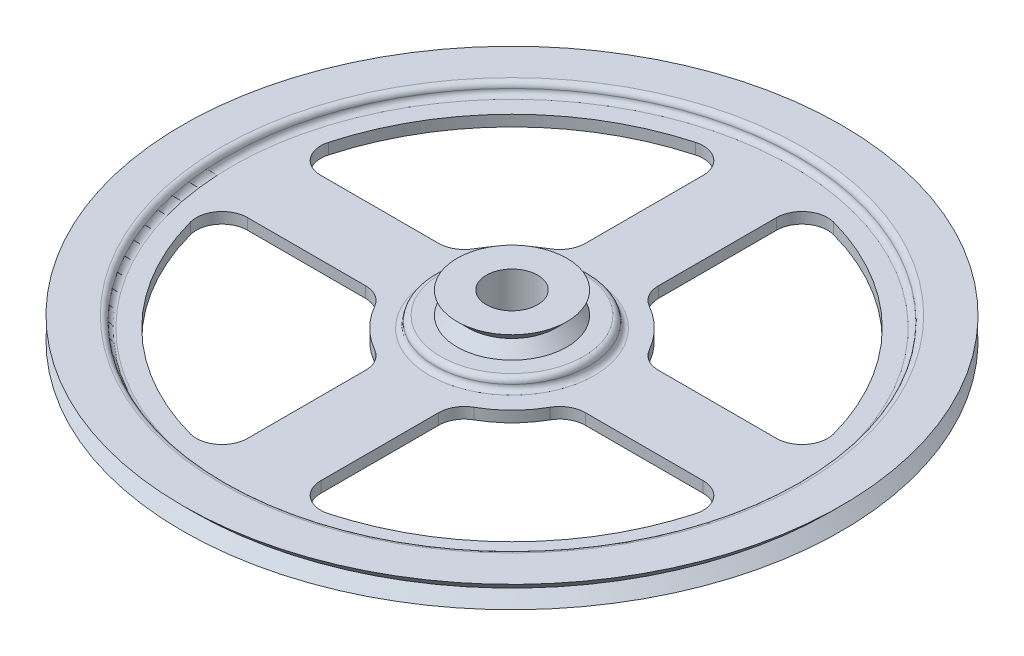
from build123d import *

# Parameters (mm, degrees)
SKETCH2_R          = 39
SKETCH2_R_2        = 10.5
CUT_EXTRUDE1_DEPTH = 1.5
FILLET1_R          = 0.75
CUT_EXTRUDE2_DEPTH = 1.5
FILLET2_R          = 3.5


with BuildPart() as part:
    # Sketch1 → Revolve1 (revolve)
    with BuildSketch(Plane.XY, mode=Mode.PRIVATE) as revolve1_sk:
        Polygon((-3.5, 6), (-3.5, 0), (-45, 0), (-43.5, 1.5), (-45, 3), (-7.5, 3), (-6, 4.5), (-7.5, 6), align=None)
    revolve(revolve1_sk.sketch.rotate(Axis((0, 0, 0), (0, 1, 0)), 270), axis=Axis((0, 0, 0), (0, 1, 0)))

    # Sketch2 → Cut-Extrude1 (cut)
    with BuildSketch(Plane(origin=(0, 3, 0), x_dir=(1, 0, 0), z_dir=(0, 1, 0))):
        with Locations(Location((0, 0, 0), (0, 0, 270))):
            Circle(SKETCH2_R)
        with Locations(Location((0, 0, 0), (0, 0, 270))):
            Circle(SKETCH2_R_2, mode=Mode.SUBTRACT)
    extrude(amount=-CUT_EXTRUDE1_DEPTH, mode=Mode.SUBTRACT)

    # Fillet1
    fillet1_edges = [part.edges().sort_by_distance(p)[0] for p in [
        (0, 1.5, -10.5),
        (0, 1.5, -39),
    ]]
    fillet(fillet1_edges, radius=FILLET1_R)
    fillet1_2_edges = [part.edges().sort_by_distance(p)[0] for p in [
        (0, 3, -39),
        (0, 3, -10.5),
    ]]
    fillet(fillet1_2_edges, radius=FILLET1_R - 0.0001)  # a hair under: the kernel refuses the full size

    # Sketch3 → Cut-Extrude2 (cut)
    with BuildSketch(Plane(origin=(0, 1.5, 0), x_dir=(1, 0, 0), z_dir=(0, 1, 0))):
        with BuildLine():
            Line((35.398622855, -5), (12.808688457, -5))
            ThreePointArc((12.808688457, -5), (9.722718241, -9.722718241), (5, -12.808688457))
            Line((5, -12.808688457), (5, -35.398622855))
            ThreePointArc((5, -35.398622855), (25.279067427, -25.279067427), (35.398622855, -5))
        make_face()
        with BuildLine():
            Line((-5, -35.398622855), (-5, -12.808688457))
            ThreePointArc((-5, -12.808688457), (-9.722718241, -9.722718241), (-12.808688457, -5))
            Line((-12.808688457, -5), (-35.398622855, -5))
            ThreePointArc((-35.398622855, -5), (-25.279067427, -25.279067427), (-5, -35.398622855))
        make_face()
        with BuildLine():
            Line((-35.398622855, 5), (-12.808688457, 5))
            ThreePointArc((-12.808688457, 5), (-9.722718241, 9.722718241), (-5, 12.808688457))
            Line((-5, 12.808688457), (-5, 35.398622855))
            ThreePointArc((-5, 35.398622855), (-25.279067427, 25.279067427), (-35.398622855, 5))
        make_face()
        with BuildLine():
            Line((5, 35.398622855), (5, 12.808688457))
            ThreePointArc((5, 12.808688457), (9.722718241, 9.722718241), (12.808688457, 5))
            Line((12.808688457, 5), (35.398622855, 5))
            ThreePointArc((35.398622855, 5), (25.279067427, 25.279067427), (5, 35.398622855))
        make_face()
    extrude(amount=-CUT_EXTRUDE2_DEPTH, mode=Mode.SUBTRACT)

    # Fillet2
    fillet2_edges = [part.edges().sort_by_distance(p)[0] for p in [
        (5, 0.75, -35.398622855),
        (35.398622855, 0.75, -5),
        (12.808688457, 0.75, -5),
        (5, 0.75, -12.808688457),
        (-5, 0.75, -12.808688457),
        (-12.808688457, 0.75, -5),
        (-35.398622855, 0.75, -5),
        (-5, 0.75, -35.398622855),
        (-12.808688457, 0.75, 5),
        (-5, 0.75, 12.808688457),
        (-5, 0.75, 35.398622855),
        (-35.398622855, 0.75, 5),
        (35.398622855, 0.75, 5),
        (5, 0.75, 35.398622855),
        (5, 0.75, 12.808688457),
        (12.808688457, 0.75, 5),
    ]]
    fillet(fillet2_edges, radius=FILLET2_R)


solid = part.part
